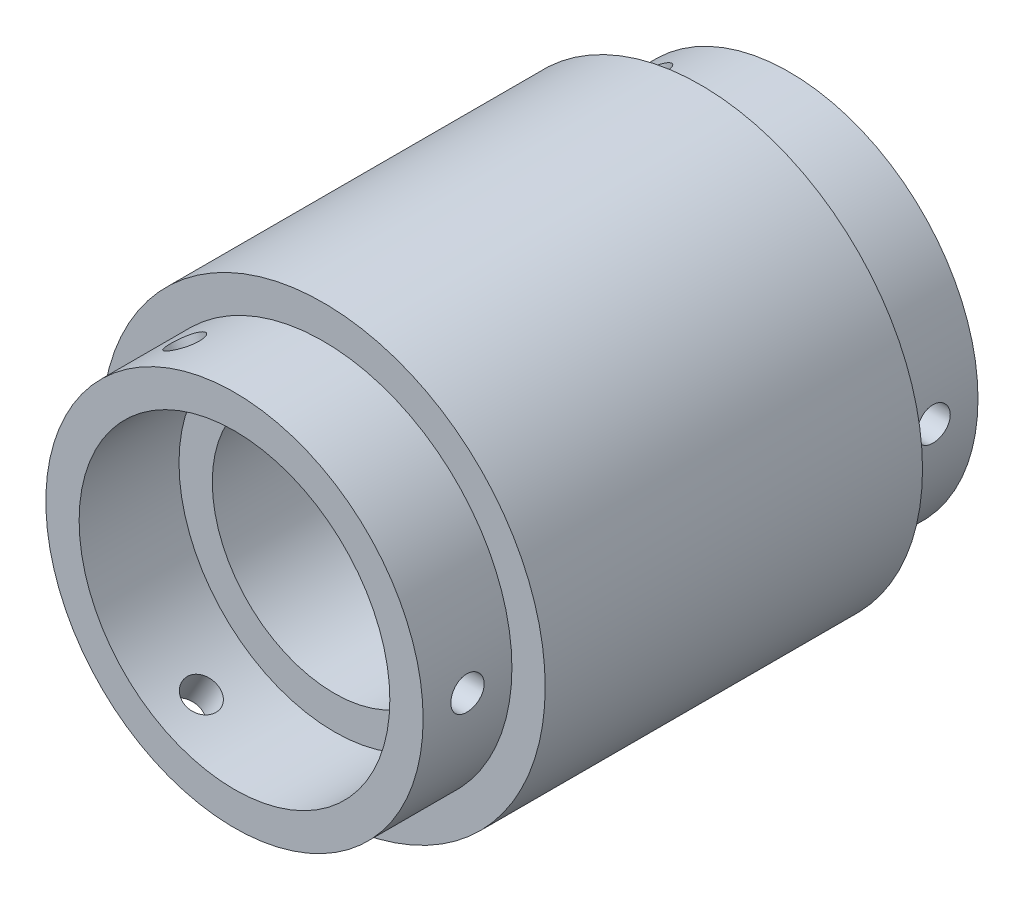
from build123d import *

# Parameters (mm, degrees)
SKETCH1_R               = 20
BOSS_EXTRUDE1_DEPTH     = 25
SKETCH4_R               = 20
SKETCH4_R_2             = 17
CUT_EXTRUDE1_DEPTH      = 8
CUT_EXTRUDE2_REACH      = 39.749
CUT_EXTRUDE2_END_RADIUS = 17
SKETCH5_R               = 1.5
CIRPATTERN1_COUNT       = 3


with BuildPart() as part:
    # Sketch1 → Boss-Extrude1 (new, symmetric)
    with BuildSketch(Plane.XY):
        Circle(SKETCH1_R)
    extrude(amount=BOSS_EXTRUDE1_DEPTH, both=True)

    # Sketch3 → Hole1 (revolve, cut)
    with BuildSketch(Plane(origin=(0, 0, 25), x_dir=(0, -1, 0), z_dir=(1, 0, 0))):
        Polygon((0, 0), (0, 56.609466809), (11, 50), (11, 9), (14, 9), (14, 0), align=None)
    hole1 = revolve(axis=Axis((0, 0, 36.310875039), (0, 0, -1)), mode=Mode.SUBTRACT)

    # Sketch4 → Cut-Extrude1 (cut)
    with BuildSketch(Plane.XY.offset(25)):
        Circle(SKETCH4_R)
        Circle(SKETCH4_R_2, mode=Mode.SUBTRACT)
    cut_extrude1 = extrude(amount=-CUT_EXTRUDE1_DEPTH, mode=Mode.SUBTRACT)

    # Mirror2: Hole1, Cut-Extrude1 across plane
    add(hole1.mirror(Plane.XY), mode=Mode.SUBTRACT)
    add(cut_extrude1.mirror(Plane.XY), mode=Mode.SUBTRACT)

    # Cut-Extrude2: up to this cylinder (the profile starts inside it)
    cut_extrude2_end = Plane(origin=(0, 0, 0), z_dir=(0, 0, -1)) * Cylinder(CUT_EXTRUDE2_END_RADIUS, 156.498, mode=Mode.PRIVATE)
    # Sketch5 → Cut-Extrude2 (cut, up to the surface)
    with BuildSketch(Plane(origin=(0, 0, 0), x_dir=(0, 0, -1), z_dir=(1, 0, 0)), mode=Mode.PRIVATE) as cut_extrude2_sk1:
        with Locations((-21, 0)):
            Circle(SKETCH5_R)
    cut_extrude2_tool1 = extrude(cut_extrude2_sk1.sketch, amount=CUT_EXTRUDE2_REACH, mode=Mode.PRIVATE) & cut_extrude2_end
    # Sketch5 → Cut-Extrude2 (cut, up to the surface)
    with BuildSketch(Plane(origin=(0, 0, 0), x_dir=(0, 0, -1), z_dir=(1, 0, 0)), mode=Mode.PRIVATE) as cut_extrude2_sk2:
        with Locations((21, 0)):
            Circle(SKETCH5_R)
    cut_extrude2_tool2 = extrude(cut_extrude2_sk2.sketch, amount=CUT_EXTRUDE2_REACH, mode=Mode.PRIVATE) & cut_extrude2_end
    cut_extrude2 = cut_extrude2_tool1.solids().sort_by_distance((0, 0, 21))[0] + cut_extrude2_tool2.solids().sort_by_distance((0, 0, -21))[0]
    add(cut_extrude2, mode=Mode.SUBTRACT)

    # CirPattern1: Cut-Extrude2 ×3 about axis
    cirpattern1_axis = Axis((0, 0, 25), (0, 0, 1))
    for i in range(1, CIRPATTERN1_COUNT):
        add(cut_extrude2.rotate(cirpattern1_axis, i * 360 / CIRPATTERN1_COUNT), mode=Mode.SUBTRACT)


solid = part.part
